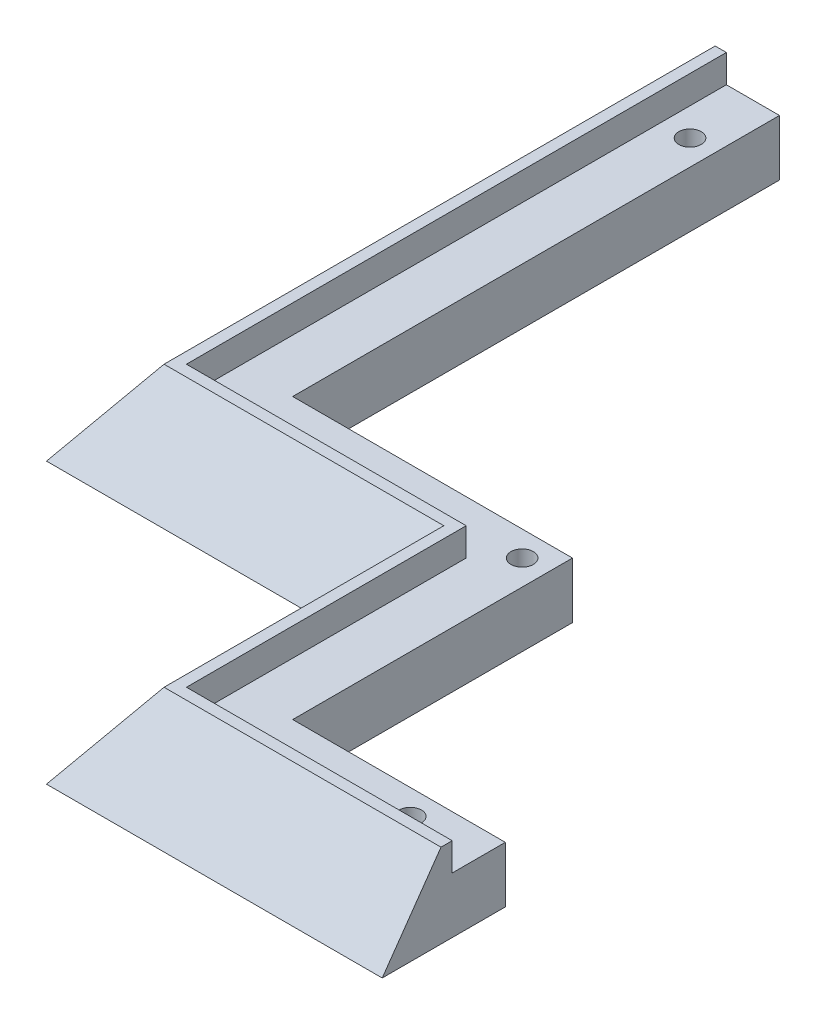
from build123d import *
from OCP.BRepFilletAPI import BRepFilletAPI_MakeChamfer

# Parameters (mm, degrees)
BOSS_EXTRU_1_DEPTH      = 15
CHANFREIN1_SIZE         = 10.503113073
CHANFREIN1_SIZE_2       = 15
ESQUISSE4_R             = 2
ENL_V_MAT_EXTRU_3_DEPTH = 4
ENL_V_MAT_EXTRU_5_DEPTH = 5
ESQUISSE6_R             = 2
ENL_V_MAT_EXTRU_6_DEPTH = 5


with BuildPart() as part:
    # Esquisse1 → Boss.-Extru.1 (new body)
    with BuildSketch(Plane(origin=(0, 0, 0), x_dir=(1, 0, 0), z_dir=(0, 1, 0))):
        Polygon((-41.352348911, -18.647651089), (8.647651089, -18.647651089), (8.647651089, -68.647651089), (68.647651089, -68.647651089), (68.647651089, -46.647651089), (30.647651089, -46.647651089), (30.647651089, 3.352348911), (-19.352348911, 3.352348911), (-19.352348911, 41.352348911), (-19.352348911, 90.352348911), (-41.352348911, 90.352348911), (-41.352348911, 41.352348911), align=None)
    extrude(amount=BOSS_EXTRU_1_DEPTH)

    # Chanfrein1
    chanfrein1_edges_1 = [part.edges().sort_by_distance(p)[0] for p in [
        (38.647651089, 15, 68.647651089),
    ]]
    chanfrein1_side_1 = [part.faces().sort_by_distance(p)[0] for p in [
        (38.647651089, 15, 68.437588827),
    ]]
    chanfrein1_edges_2 = [part.edges().sort_by_distance(p)[0] for p in [
        (8.647651089, 15, 43.647651089),
    ]]
    chanfrein1_side_2 = [part.faces().sort_by_distance(p)[0] for p in [
        (8.85771335, 15, 43.647651089),
    ]]
    chanfrein1_edges_3 = [part.edges().sort_by_distance(p)[0] for p in [
        (-16.352348911, 15, 18.647651089),
    ]]
    chanfrein1_side_3 = [part.faces().sort_by_distance(p)[0] for p in [
        (-16.352348911, 14.789937739, 18.647651089),
    ]]
    chanfrein1_edges_4 = [part.edges().sort_by_distance(p)[0] for p in [
        (-41.352348911, 15, -35.852348911),
    ]]
    chanfrein1_side_4 = [part.faces().sort_by_distance(p)[0] for p in [
        (-41.14228665, 15, -35.852348911),
    ]]
    chanfrein1 = BRepFilletAPI_MakeChamfer(part.part.solid().wrapped)
    for e in chanfrein1_edges_1:
        chanfrein1.Add(CHANFREIN1_SIZE - 0.0001, CHANFREIN1_SIZE_2 - 0.0001, e.wrapped, chanfrein1_side_1[0].wrapped)
    for e in chanfrein1_edges_2:
        chanfrein1.Add(CHANFREIN1_SIZE - 0.0001, CHANFREIN1_SIZE_2 - 0.0001, e.wrapped, chanfrein1_side_2[0].wrapped)
    for e in chanfrein1_edges_3:
        chanfrein1.Add(CHANFREIN1_SIZE_2 - 0.0001, CHANFREIN1_SIZE - 0.0001, e.wrapped, chanfrein1_side_3[0].wrapped)
    for e in chanfrein1_edges_4:
        chanfrein1.Add(CHANFREIN1_SIZE - 0.0001, CHANFREIN1_SIZE_2 - 0.0001, e.wrapped, chanfrein1_side_4[0].wrapped)
    add(Compound.cast(chanfrein1.Shape()), mode=Mode.REPLACE)  # a hair under: the kernel refuses the full size

    # Esquisse4 → Enlèv. mat.-Extru.3 (cut)
    with BuildSketch(Plane.XZ):
        with Locations(Location((38.647651089, 63.647651089, 0), (0, 0, 270))):
            Circle(ESQUISSE4_R)
        with Locations(Location((13.647651089, 38.647651089, 0), (0, 0, 270))):
            Circle(ESQUISSE4_R)
        with Locations(Location((-11.352348911, 13.647651089, 0), (0, 0, 270))):
            Circle(ESQUISSE4_R)
    extrude(amount=-ENL_V_MAT_EXTRU_3_DEPTH, mode=Mode.SUBTRACT)

    # Esquisse5 → Enlèv. mat.-Extru.5 (cut)
    with BuildSketch(Plane(origin=(0, 15, 0), x_dir=(1, 0, 0), z_dir=(0, 1, 0))):
        Polygon((-19.352348911, 3.352348911), (30.647651089, 3.352348911), (30.647651089, -46.647651089), (68.647651089, -46.647651089), (68.647651089, -56.140382231), (21.150764162, -56.140382231), (21.150764162, -6.144538016), (-28.849235838, -6.144538016), (-28.849235838, 90.352348911), (-19.352348911, 90.352348911), align=None)
    extrude(amount=-ENL_V_MAT_EXTRU_5_DEPTH, mode=Mode.SUBTRACT)

    # Esquisse6 → Enlèv. mat.-Extru.6 (cut)
    with BuildSketch(Plane(origin=(0, 10, 0), x_dir=(1, 0, 0), z_dir=(0, 1, 0))):
        with Locations(Location((-23.849235838, 78.855461984, 0), (0, 0, 270))):
            Circle(ESQUISSE6_R)
        with Locations(Location((26.150764162, -1.144538016, 0), (0, 0, 270))):
            Circle(ESQUISSE6_R)
        with Locations(Location((56.150764162, -51.140382231, 0), (0, 0, 270))):
            Circle(ESQUISSE6_R)
    extrude(amount=-ENL_V_MAT_EXTRU_6_DEPTH, mode=Mode.SUBTRACT)


solid = part.part
